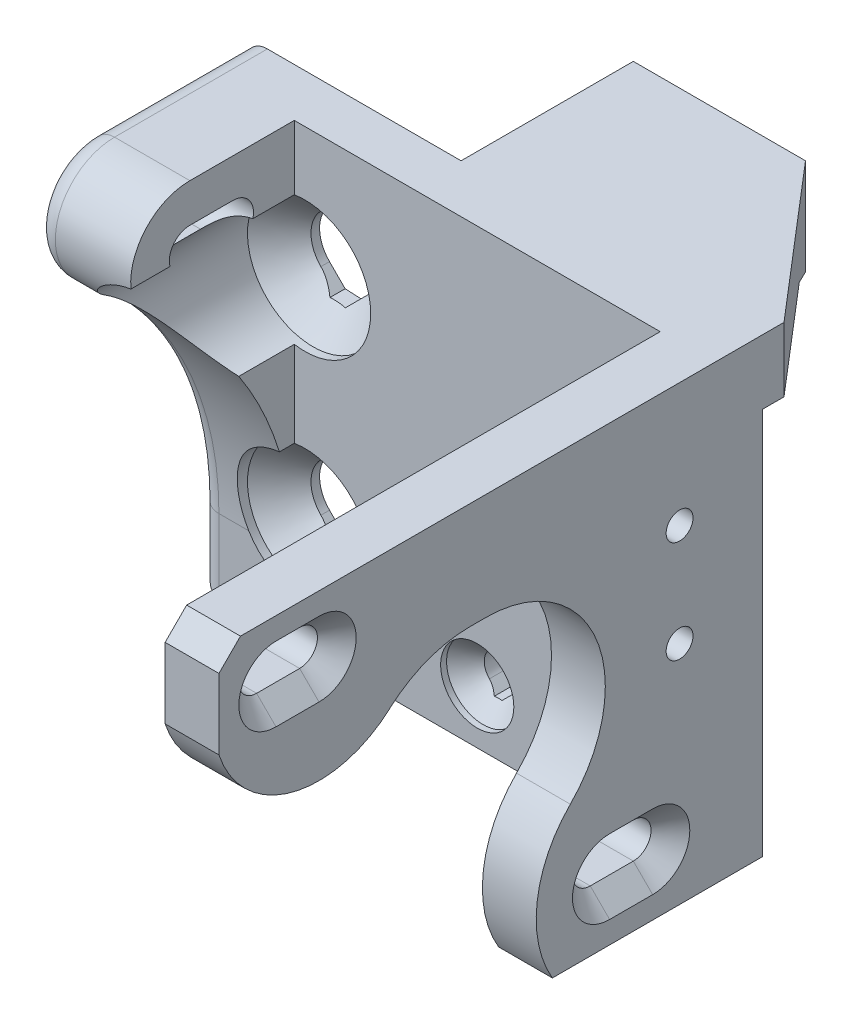
from build123d import *

# Parameters (mm, degrees)
SKETCH1_R                = 3.15
BOSS_EXTRUDE1_DEPTH      = 4.5
SKETCH4_W                = 28
SKETCH4_H                = 6
BOSS_EXTRUDE2_DEPTH      = 16
BOSS_EXTRUDE4_DEPTH      = 6
CHAMFER8_START           = 16
CHAMFER8_DEPTH           = 0.271535122
CHAMFER8_START_2         = -16
CHAMFER8_2_DEPTH         = 10.9
CHAMFER8_START_3         = 16.271535122
CHAMFER8_3_DEPTH         = 5.958767963
CUT_EXTRUDE6_REACH       = 41.038
SKETCH10_R               = 2.15
CUT_EXTRUDE7_REACH       = 48.538
CUT_EXTRUDE7_START       = -7.5
SKETCH11_R               = 4.1
CHAMFER9_SIZE            = 2
SKETCH12_W               = 5
SKETCH12_H               = 42
SKETCH12_W_2             = 9
BOSS_EXTRUDE5_DEPTH      = 46
CUT_EXTRUDE8_DEPTH       = 70.880254722
CUT_EXTRUDE9_DEPTH       = 9
CHAMFER11_SIZE           = 12
CHAMFER11_SIZE2          = 14
CUT_EXTRUDE11_REACH      = 65.592
SKETCH16_R               = 1.6
FILLET1_R                = 2
CHAMFER13_SIZE           = 2
CHAMFER14_SIZE           = 1.8
CUT_EXTRUDE13_DEPTH      = 0.7
CUT_EXTRUDE13_DEPTH_BACK = 64.592452382
SKETCH18_R               = 6.1
CHAMFER15_SIZE           = 3
CUT_EXTRUDE14_DEPTH      = 64.592452417
SKETCH24_R               = 1.25
CUT_EXTRUDE18_DEPTH      = 5
CUT_EXTRUDE19_REACH      = 68.92
SKETCH25_R               = 1.65
CUT_EXTRUDE20_DEPTH      = 0.5
CUT_EXTRUDE20_DEPTH_BACK = 64.592452417
SKETCH26_R               = 3.4
CHAMFER16_SIZE           = 1.8
CUT_EXTRUDE21_DEPTH      = 64.592452417
CUT_EXTRUDE23_DEPTH      = 62.791989808


with BuildPart() as part:
    # Sketch1 → Boss-Extrude1 (new body)
    with BuildSketch(Plane.XY):
        Polygon((-10, 22), (-10, -20), (10, -20), (38, -20), (38, 22), align=None)
        with Locations((0, 10)):
            Circle(SKETCH1_R, mode=Mode.SUBTRACT)
        with Locations((0, -10)):
            Circle(SKETCH1_R, mode=Mode.SUBTRACT)
    extrude(amount=BOSS_EXTRUDE1_DEPTH)

    # Sketch4 → Boss-Extrude2 (add)
    with BuildSketch(Plane.XY):
        with Locations((24, 19)):
            Rectangle(SKETCH4_W, SKETCH4_H)
    extrude(amount=-BOSS_EXTRUDE2_DEPTH)

    # Sketch9 → Boss-Extrude4 (add)
    with BuildSketch(Plane.ZY.offset(-10)):
        with BuildLine():
            Line((-16, 16), (-16, 9.9))
            ThreePointArc((-16, 9.9), (-14.535533906, 6.364466094), (-11, 4.9))
            Line((-11, 4.9), (-5.1, 4.9))
            Line((-5.1, 4.9), (-5.1, 16))
            Line((-5.1, 16), (-16, 16))
        make_face()
    extrude(amount=-BOSS_EXTRUDE4_DEPTH)

    # Chamfer8: read off the stored shape, not the designer's step
    # Chamfer8 outline → Chamfer8 (add)
    with BuildSketch(Plane.YZ.offset(CHAMFER8_START)):
        with BuildLine():
            ThreePointArc((4.9, -11), (6.364466094, -14.535533906), (9.9, -16))
            Line((9.9, -16), (16, -16))
            Line((16, -16), (16, -5.1))
            Line((16, -5.1), (4.9, -5.1))
            Line((4.9, -5.1), (4.9, -11))
        make_face()
    extrude(amount=CHAMFER8_DEPTH)

    # Chamfer8 2 outline → Chamfer8 2 (add)
    with BuildSketch(Plane.XY.offset(CHAMFER8_START_2)):
        Polygon((16.271535122, 4.9), (29.5, 16), (16.271535122, 16), align=None)
    extrude(amount=CHAMFER8_2_DEPTH)

    # Chamfer8 3 outline → Chamfer8 3 (cut)
    with BuildSketch(Plane.YZ.offset(CHAMFER8_START_3)):
        with BuildLine():
            Line((11, -16), (9.9, -16))
            ThreePointArc((9.9, -16), (6.364466094, -14.535533906), (4.9, -11))
            Line((4.9, -11), (4.9, -10))
            Line((4.9, -10), (3, -10))
            Line((3, -10), (3, -17))
            Line((3, -17), (11, -17))
            Line((11, -17), (11, -16))
        make_face()
    extrude(amount=CHAMFER8_3_DEPTH, mode=Mode.SUBTRACT)

    # Cut-Extrude6: up to this plane
    cut_extrude6_end = Plane(origin=(29.5, 16, -16), z_dir=(-0.6427876096865436, 0.7660444431189746, 0))
    # Sketch10 → Cut-Extrude6 (cut, up to the surface)
    with BuildSketch(Plane.ZY.offset(-10), mode=Mode.PRIVATE) as cut_extrude6_sk1:
        with Locations((-11, 9.9)):
            Circle(SKETCH10_R)
    cut_extrude6_tool1 = split(extrude(cut_extrude6_sk1.sketch, amount=-CUT_EXTRUDE6_REACH, mode=Mode.PRIVATE), bisect_by=cut_extrude6_end, keep=Keep.BOTH, mode=Mode.PRIVATE)
    add(cut_extrude6_tool1.solids().sort_by_distance((10, 9.9, -11))[0], mode=Mode.SUBTRACT)

    # Sketch11 → Cut-Extrude7 (cut, up to next)
    with BuildSketch(Plane.ZY.offset(-10).offset(CUT_EXTRUDE7_START), mode=Mode.PRIVATE) as cut_extrude7_sk1:
        with Locations((-11, 9.9)):
            Circle(SKETCH11_R)
    cut_extrude7_tool1 = extrude(cut_extrude7_sk1.sketch, amount=-CUT_EXTRUDE7_REACH, mode=Mode.PRIVATE) & part.part
    add(cut_extrude7_tool1.solids().sort_by_distance((17.5, 9.9, -11))[0], mode=Mode.SUBTRACT)

    # Chamfer9
    # the kernel refuses this chamfer: 2 mm, written as the material it takes off along each edge
    with BuildSketch(Plane(origin=(17.5, 9.9, -11), x_dir=(0, 0, 1), z_dir=(0, -1, 0))) as chamfer9_piece_1_section:
        Polygon((2.15, CHAMFER9_SIZE), (2.15 + CHAMFER9_SIZE, 0), (2.15, 0), align=None)
    chamfer9_piece_1 = revolve(axis=Axis((17.5, 9.9, -11), (-1, 0, 0)), mode=Mode.PRIVATE)
    chamfer9_piece_1 = chamfer9_piece_1 & Plane(origin=(17.5, 9.9, -11), x_dir=(0, 0, 1), z_dir=(-1, 0, 0)) * Cylinder(4.1, 17, mode=Mode.PRIVATE)
    add(chamfer9_piece_1, mode=Mode.SUBTRACT)

    # Sketch12 → Boss-Extrude5 (add)
    with BuildSketch(Plane(origin=(0, 0, 4.5), x_dir=(-1, 0, 0), z_dir=(0, 0, -1))):
        with Locations((-35.5, 1)):
            Rectangle(SKETCH12_W, SKETCH12_H)
        with Locations((5.5, 1)):
            Rectangle(SKETCH12_W_2, SKETCH12_H)
    extrude(amount=-BOSS_EXTRUDE5_DEPTH)

    # Sketch13 → Cut-Extrude8 (cut, through all)
    with BuildSketch(Plane.ZY.offset(-33)):
        with BuildLine():
            Line((27.194582816, 12.1), (25.7, 12.1))
            ThreePointArc((25.7, 12.1), (15.444937189, 5.247786099), (17.851114729, -6.848885271))
            ThreePointArc((17.851114729, -6.848885271), (20.934406574, -13.139254364), (19.518214056, -20))
            Line((19.518214056, -20), (50.5, -20))
            Line((50.5, -20), (50.5, 13.440816458))
            ThreePointArc((50.5, 13.440816458), (43.708428092, 7.036576071), (34.636345331, 9.235907397))
            ThreePointArc((34.636345331, 9.235907397), (31.181525748, 11.359260884), (27.194582816, 12.1))
        make_face()
        with BuildLine():
            Line((41.2, 14.85), (45.2, 14.85))
            ThreePointArc((45.2, 14.85), (46.85, 16.5), (45.2, 18.15))
            Line((45.2, 18.15), (41.2, 18.15))
            ThreePointArc((41.2, 18.15), (39.55, 16.5), (41.2, 14.85))
        make_face()
        with BuildLine():
            Line((10.2, -16.15), (14.2, -16.15))
            ThreePointArc((14.2, -16.15), (15.85, -14.5), (14.2, -12.85))
            Line((14.2, -12.85), (10.2, -12.85))
            ThreePointArc((10.2, -12.85), (8.55, -14.5), (10.2, -16.15))
        make_face()
    extrude(amount=-CUT_EXTRUDE8_DEPTH, mode=Mode.SUBTRACT)

    # Sketch14 → Cut-Extrude9 (cut)
    with BuildSketch(Plane.ZY.offset(10)):
        with BuildLine():
            Line((14.2, 18.408592628), (10.2, 18.408592628))
            ThreePointArc((10.2, 18.408592628), (8.291407372, 16.5), (10.2, 14.591407372))
            Line((10.2, 14.591407372), (14.2, 14.591407372))
            ThreePointArc((14.2, 14.591407372), (16.108592628, 16.5), (14.2, 18.408592628))
        make_face()
        with BuildLine():
            Line((4.5, -13.140512816), (4.5, -44.140512816))
            Line((4.5, -44.140512816), (35.5, -44.140512816))
            ThreePointArc((35.5, -44.140512816), (57.420310217, -35.060823033), (66.5, -13.140512816))
            Line((66.5, -13.140512816), (66.5, 22))
            Line((66.5, 22), (14.2, 22))
            ThreePointArc((14.2, 22), (19.435221225, 18.185959291), (17.409589041, 12.033621356))
            ThreePointArc((17.409589041, 12.033621356), (7.915559279, 1.00510948), (4.5, -13.140512816))
        make_face()
    extrude(amount=-CUT_EXTRUDE9_DEPTH, mode=Mode.SUBTRACT)

    # Chamfer11
    chamfer11_edges = [part.edges().sort_by_distance(p)[0] for p in [
        (38, 19, -16),
    ]]
    chamfer11_side = [part.faces().sort_by_distance(p)[0] for p in [
        (21.833057839, 16.873831954, -16),
    ]]
    chamfer(chamfer11_edges, length=CHAMFER11_SIZE, length2=CHAMFER11_SIZE2, reference=chamfer11_side[0])

    # Sketch16 → Cut-Extrude11 (cut, up to next)
    with BuildSketch(Plane.XY.offset(4.5), mode=Mode.PRIVATE) as cut_extrude11_sk1:
        with Locations((30, -8)):
            Circle(SKETCH16_R)
    cut_extrude11_tool1 = extrude(cut_extrude11_sk1.sketch, amount=-CUT_EXTRUDE11_REACH, mode=Mode.PRIVATE) & part.part
    add(cut_extrude11_tool1.solids().sort_by_distance((30, -8, 4.5))[0], mode=Mode.SUBTRACT)

    # Fillet1
    fillet1_edges = [part.edges().sort_by_distance(p)[0] for p in [
        (-10, -20, 2.25),
        (-10, 22, 7.1),
        (-10, -16.570256408, 4.5),
        (-10, 1.00510948, 7.915559279),
        (-10, 18.185959291, 19.435221225),
    ]]
    fillet(fillet1_edges, radius=FILLET1_R)

    # Chamfer13
    chamfer13_edges = [part.edges().sort_by_distance(p)[0] for p in [
        (35.5, 22, 50.5),
    ]]
    chamfer(chamfer13_edges, length=CHAMFER13_SIZE)

    # Chamfer14
    chamfer14_edges = [part.edges().sort_by_distance(p)[0] for p in [
        (38, 16.5, 39.55),
        (38, 18.15, 43.2),
        (38, 16.5, 46.85),
        (38, 14.85, 43.2),
        (38, -14.5, 8.55),
        (38, -12.85, 12.2),
        (38, -14.5, 15.85),
        (38, -16.15, 12.2),
    ]]
    chamfer(chamfer14_edges, length=CHAMFER14_SIZE)

    # Sketch18 → Cut-Extrude13 (cut, two sides: drawn at the far end of the back side and taken through both)
    with BuildSketch(Plane(origin=(0, 0, 4.5), x_dir=(-1, 0, 0), z_dir=(0, 0, -1)).offset(-CUT_EXTRUDE13_DEPTH_BACK)):
        with Locations((0, 10)):
            Circle(SKETCH18_R)
        with Locations((0, -10)):
            Circle(SKETCH18_R)
    extrude(amount=CUT_EXTRUDE13_DEPTH + CUT_EXTRUDE13_DEPTH_BACK, mode=Mode.SUBTRACT)

    # Chamfer15
    # the kernel refuses this chamfer: 3 mm, written as the material it takes off along each edge
    with BuildSketch(Plane(origin=(0, -10, 3.8), x_dir=(1, 0, 0), z_dir=(0, 1, 0))) as chamfer15_piece_1_section:
        Polygon((3.15 + CHAMFER15_SIZE, 0), (3.15, CHAMFER15_SIZE), (3.15, 0), align=None)
    chamfer15_piece_1 = revolve(axis=Axis((0, -10, 3.8), (0, 0, -1)), mode=Mode.PRIVATE)
    chamfer15_piece_1 = chamfer15_piece_1 & Plane(origin=(0, -10, 3.8), x_dir=(-1, 0, 0), z_dir=(0, 0, 1)) * Cylinder(6.1, 25, mode=Mode.PRIVATE)
    add(chamfer15_piece_1, mode=Mode.SUBTRACT)
    with BuildSketch(Plane(origin=(0, 10, 3.8), x_dir=(1, 0, 0), z_dir=(0, 1, 0))) as chamfer15_piece_2_section:
        Polygon((3.15 + CHAMFER15_SIZE, 0), (3.15, CHAMFER15_SIZE), (3.15, 0), align=None)
    chamfer15_piece_2 = revolve(axis=Axis((0, 10, 3.8), (0, 0, -1)), mode=Mode.PRIVATE)
    chamfer15_piece_2 = chamfer15_piece_2 & Plane(origin=(0, 10, 3.8), x_dir=(-1, 0, 0), z_dir=(0, 0, 1)) * Cylinder(6.1, 25, mode=Mode.PRIVATE)
    add(chamfer15_piece_2, mode=Mode.SUBTRACT)

    # Sketch20 → Cut-Extrude14 (cut, through all)
    with BuildSketch(Plane.XY.offset(4.5)):
        Polygon((0, -10), (2.227386361, -12.227386361), (0.684772721, -13.77), (-0.684772721, -13.77), (-2.227386361, -12.227386361), align=None)
        Polygon((0.699417382, 6.244644661), (-0.772212816, 6.317440094), (-2.227386361, 7.772613639), (0, 10), (2.227386361, 7.772613639), align=None)
    extrude(amount=-CUT_EXTRUDE14_DEPTH, mode=Mode.SUBTRACT)

    # Sketch24 → Cut-Extrude18 (cut)
    with BuildSketch(Plane(origin=(38, 0, 0), x_dir=(0, 0, -1), z_dir=(1, 0, 0))):
        with Locations(Location((-7.7, 10.5, 0), (0, 0, 90))):
            Circle(SKETCH24_R)
        with Locations(Location((-7.7, 1, 0), (0, 0, 90))):
            Circle(SKETCH24_R)
    extrude(amount=-CUT_EXTRUDE18_DEPTH, mode=Mode.SUBTRACT)

    # Sketch25 → Cut-Extrude19 (cut, up to next)
    with BuildSketch(Plane(origin=(0, 0, 0), x_dir=(-1, 0, 0), z_dir=(0, 0, -1)), mode=Mode.PRIVATE) as cut_extrude19_sk1:
        with Locations((-16, -15)):
            Circle(SKETCH25_R)
    cut_extrude19_tool1 = extrude(cut_extrude19_sk1.sketch, amount=-CUT_EXTRUDE19_REACH, mode=Mode.PRIVATE) & part.part
    # Sketch25 → Cut-Extrude19 (cut, up to next)
    with BuildSketch(Plane(origin=(0, 0, 0), x_dir=(-1, 0, 0), z_dir=(0, 0, -1)), mode=Mode.PRIVATE) as cut_extrude19_sk2:
        with Locations((-28, 10)):
            Circle(SKETCH25_R)
    cut_extrude19_tool2 = extrude(cut_extrude19_sk2.sketch, amount=-CUT_EXTRUDE19_REACH, mode=Mode.PRIVATE) & part.part
    add(cut_extrude19_tool1.solids().sort_by_distance((16, -15, 0))[0], mode=Mode.SUBTRACT)
    add(cut_extrude19_tool2.solids().sort_by_distance((28, 10, 0))[0], mode=Mode.SUBTRACT)

    # Sketch26 → Cut-Extrude20 (cut, two sides: drawn at the far end of the back side and taken through both)
    with BuildSketch(Plane(origin=(0, 0, 4.5), x_dir=(-1, 0, 0), z_dir=(0, 0, -1)).offset(-CUT_EXTRUDE20_DEPTH_BACK)):
        with Locations((-16, -15)):
            Circle(SKETCH26_R)
        with Locations((-28, 10)):
            Circle(SKETCH26_R)
    extrude(amount=CUT_EXTRUDE20_DEPTH + CUT_EXTRUDE20_DEPTH_BACK, mode=Mode.SUBTRACT)

    # Chamfer16
    # the kernel refuses this chamfer: 1.8 mm, written as the material it takes off along each edge
    with BuildSketch(Plane(origin=(28, 10, 4), x_dir=(-1, 0, 0), z_dir=(0, -1, 0))) as chamfer16_piece_1_section:
        Polygon((1.65, CHAMFER16_SIZE), (1.65 + CHAMFER16_SIZE, 0), (1.65, 0), align=None)
    chamfer16_piece_1 = revolve(axis=Axis((28, 10, 4), (0, 0, -1)), mode=Mode.PRIVATE)
    chamfer16_piece_1 = chamfer16_piece_1 & Plane(origin=(28, 10, 4), x_dir=(-1, 0, 0), z_dir=(0, 0, 1)) * Cylinder(3.4, 14, mode=Mode.PRIVATE)
    add(chamfer16_piece_1, mode=Mode.SUBTRACT)
    with BuildSketch(Plane(origin=(16, -15, 4), x_dir=(-1, 0, 0), z_dir=(0, -1, 0))) as chamfer16_piece_2_section:
        Polygon((1.65, CHAMFER16_SIZE), (1.65 + CHAMFER16_SIZE, 0), (1.65, 0), align=None)
    chamfer16_piece_2 = revolve(axis=Axis((16, -15, 4), (0, 0, -1)), mode=Mode.PRIVATE)
    chamfer16_piece_2 = chamfer16_piece_2 & Plane(origin=(16, -15, 4), x_dir=(-1, 0, 0), z_dir=(0, 0, 1)) * Cylinder(3.4, 14, mode=Mode.PRIVATE)
    add(chamfer16_piece_2, mode=Mode.SUBTRACT)

    # Sketch27 → Cut-Extrude21 (cut, through all)
    with BuildSketch(Plane.XY.offset(4.5)):
        Polygon((16, -15), (14.833273811, -16.166726189), (15.646547622, -16.98), (16.353452378, -16.98), (17.166726189, -16.166726189), align=None)
        Polygon((26.833273811, 8.833273811), (27.646547622, 8.02), (28.353452378, 8.02), (29.166726189, 8.833273811), (28, 10), align=None)
    extrude(amount=-CUT_EXTRUDE21_DEPTH, mode=Mode.SUBTRACT)

    # Sketch29 → Cut-Extrude23 (cut, through all)
    with BuildSketch(Plane.ZY.offset(-10)):
        Polygon((-11, 9.9), (-12.52027958, 8.37972042), (-11.470559159, 7.33), (-10.529440841, 7.33), (-9.47972042, 8.37972042), align=None)
    extrude(amount=-CUT_EXTRUDE23_DEPTH, mode=Mode.SUBTRACT)


solid = part.part
